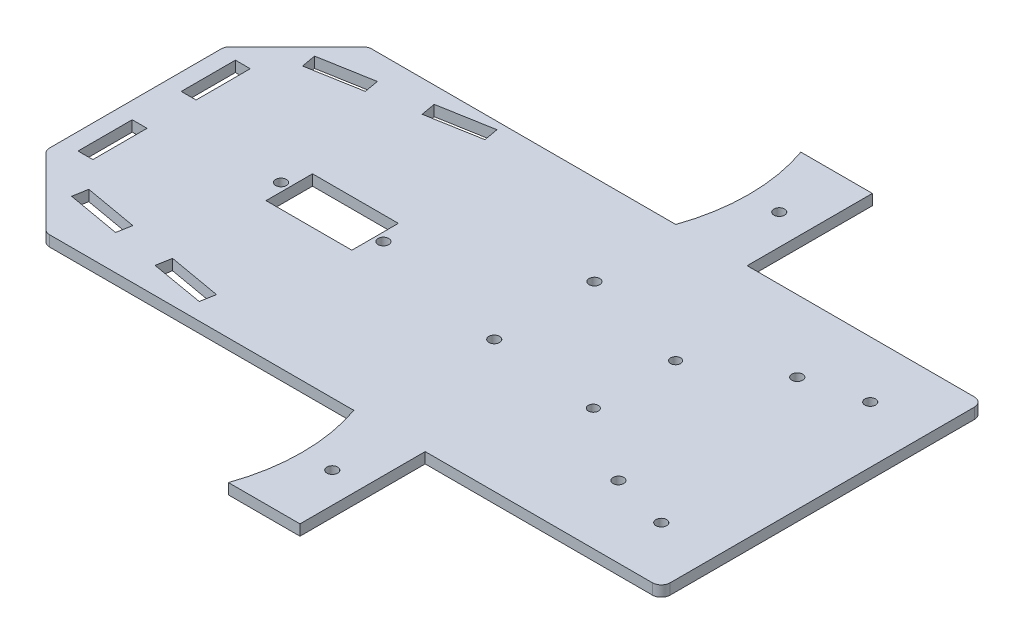
from build123d import *

# Parameters (mm, degrees)
SKETCH1_W           = 192
SKETCH1_H           = 90
BOSS_EXTRUDE1_DEPTH = 3
SKETCH3_W           = 20
SKETCH3_H           = 35
BOSS_EXTRUDE2_DEPTH = 3
CUT_EXTRUDE1_DEPTH  = 5
SKETCH5_R           = 1.4
CUT_EXTRUDE2_DEPTH  = 5
SKETCH6_R           = 1.4
CUT_EXTRUDE3_DEPTH  = 5
SKETCH7_R           = 1.5
SKETCH7_W           = 24
SKETCH7_H           = 13
CUT_EXTRUDE4_DEPTH  = 5
SKETCH8_R           = 1.5
CUT_EXTRUDE5_DEPTH  = 5000
SKETCH10_R          = 1.5
CUT_EXTRUDE6_DEPTH  = 230.124420348
SKETCH11_R          = 1.5
CUT_EXTRUDE7_DEPTH  = 230.124420348
SKETCH13_R          = 1.5
CUT_EXTRUDE9_DEPTH  = 230.124420348
SKETCH18_W          = 4.15
SKETCH18_H          = 15.15
CUT_EXTRUDE10_DEPTH = 10
CUT_EXTRUDE11_DEPTH = 10
FILLET1_R           = 2.5


with BuildPart() as part:
    # Sketch1 → Boss-Extrude1 (new body)
    with BuildSketch(Plane(origin=(0, 0, 0), x_dir=(1, 0, 0), z_dir=(0, 1, 0))):
        with Locations((96, 45)):
            Rectangle(SKETCH1_W, SKETCH1_H)
    extrude(amount=BOSS_EXTRUDE1_DEPTH)

    # Sketch3 → Boss-Extrude2 (add)
    with BuildSketch(Plane(origin=(0, 3, 0), x_dir=(1, 0, 0), z_dir=(0, 1, 0))):
        with Locations((116, 107.5)):
            Rectangle(SKETCH3_W, SKETCH3_H)
    boss_extrude2 = extrude(amount=-BOSS_EXTRUDE2_DEPTH)

    # Sketch4 → Cut-Extrude1 (cut)
    with BuildSketch(Plane(origin=(0, 3, 0), x_dir=(1, 0, 0), z_dir=(0, 1, 0))):
        with BuildLine():
            Line((106, 125), (106, 89.875029968))
            ThreePointArc((106, 89.875029968), (109, 107.437514984), (106, 125))
        make_face()
    cut_extrude1 = extrude(amount=-CUT_EXTRUDE1_DEPTH, mode=Mode.SUBTRACT)

    # Mirror1: Boss-Extrude2, Cut-Extrude1 across plane
    add(boss_extrude2.mirror(Plane.XY.offset(-45)))
    add(cut_extrude1.mirror(Plane.XY.offset(-45)), mode=Mode.SUBTRACT)

    # Sketch5 → Cut-Extrude2 (cut)
    with BuildSketch(Plane(origin=(0, 3, 0), x_dir=(1, 0, 0), z_dir=(0, 1, 0))):
        with Locations((139, 57)):
            Circle(SKETCH5_R)
    extrude(amount=-CUT_EXTRUDE2_DEPTH, mode=Mode.SUBTRACT)

    # Sketch6 → Cut-Extrude3 (cut)
    with BuildSketch(Plane(origin=(0, 3, 0), x_dir=(1, 0, 0), z_dir=(0, 1, 0))):
        with Locations((139, 34)):
            Circle(SKETCH6_R)
    extrude(amount=-CUT_EXTRUDE3_DEPTH, mode=Mode.SUBTRACT)

    # Sketch7 → Cut-Extrude4 (cut)
    with BuildSketch(Plane(origin=(0, 3, 0), x_dir=(1, 0, 0), z_dir=(0, 1, 0))):
        with Locations((40.7, 45)):
            Circle(SKETCH7_R)
        with Locations((69.3, 45)):
            Circle(SKETCH7_R)
        with Locations((55, 45)):
            Rectangle(SKETCH7_W, SKETCH7_H)
    extrude(amount=-CUT_EXTRUDE4_DEPTH, mode=Mode.SUBTRACT)

    # Sketch8 → Cut-Extrude5 (cut)
    with BuildSketch(Plane(origin=(0, 3, 0), x_dir=(1, 0, 0), z_dir=(0, 1, 0))):
        with Locations((160, 20)):
            Circle(SKETCH8_R)
        with Locations((160, 70)):
            Circle(SKETCH8_R)
    extrude(amount=-CUT_EXTRUDE5_DEPTH, mode=Mode.SUBTRACT)

    # Sketch10 → Cut-Extrude6 (cut, through all)
    with BuildSketch(Plane(origin=(0, 3, 0), x_dir=(1, 0, 0), z_dir=(0, 1, 0))):
        with Locations((117.5, -17.468757492)):
            Circle(SKETCH10_R)
        with Locations((117.5, 107.468757492)):
            Circle(SKETCH10_R)
    extrude(amount=-CUT_EXTRUDE6_DEPTH, mode=Mode.SUBTRACT)

    # Sketch11 → Cut-Extrude7 (cut, through all)
    with BuildSketch(Plane(origin=(0, 3, 0), x_dir=(1, 0, 0), z_dir=(0, 1, 0))):
        with Locations((176.2, 74.2)):
            Circle(SKETCH11_R)
        with Locations((176.2, 15.8)):
            Circle(SKETCH11_R)
    extrude(amount=-CUT_EXTRUDE7_DEPTH, mode=Mode.SUBTRACT)

    # Sketch13 → Cut-Extrude9 (cut, through all)
    with BuildSketch(Plane(origin=(0, 3, 0), x_dir=(1, 0, 0), z_dir=(0, 1, 0))):
        with Locations((108.5, 36.8)):
            Circle(SKETCH13_R)
        with Locations((108.5, 64.8)):
            Circle(SKETCH13_R)
    extrude(amount=-CUT_EXTRUDE9_DEPTH, mode=Mode.SUBTRACT)

    # Sketch18 → Cut-Extrude10 (cut)
    with BuildSketch(Plane(origin=(0, 3, 0), x_dir=(1, 0, 0), z_dir=(0, 1, 0))):
        with Locations((6.7900071, 31.808623805)):
            Rectangle(SKETCH18_W, SKETCH18_H)
        with Locations((6.7900071, 60.658623805)):
            Rectangle(SKETCH18_W, SKETCH18_H)
        Polygon((14.797251371, 80.27993706), (29.717088829, 82.910706951), (30.437728767, 78.823754776), (15.517891309, 76.192984885), align=None)
        Polygon((58.115112636, 87.949448395), (43.195275178, 85.318678504), (43.915915115, 81.231726329), (58.835752574, 83.86249622), align=None)
        Polygon((15.491844082, 16.476152834), (30.41168154, 13.845382942), (29.691041603, 9.758430767), (14.771204145, 12.389200659), align=None)
        Polygon((58.823385214, 8.835633017), (43.90371289, 11.466373791), (43.17069547, 7.309225426), (58.102745277, 4.748680842), align=None)
    extrude(amount=-CUT_EXTRUDE10_DEPTH, mode=Mode.SUBTRACT)

    # Sketch19 → Cut-Extrude11 (cut)
    with BuildSketch(Plane(origin=(0, 3, 0), x_dir=(1, 0, 0), z_dir=(0, 1, 0))):
        Polygon((0, 90), (20, 90), (0, 70), align=None)
        Polygon((0, 0), (0, 20), (20, 0), align=None)
    extrude(amount=-CUT_EXTRUDE11_DEPTH, mode=Mode.SUBTRACT)

    # Fillet1
    fillet1_edges = [part.edges().sort_by_distance(p)[0] for p in [
        (192, 1.5, 0),
        (192, 1.5, -90),
        (20, 1.5, 0),
        (0, 1.5, -20),
        (20, 1.5, -90),
        (0, 1.5, -70),
    ]]
    fillet(fillet1_edges, radius=FILLET1_R)


solid = part.part
